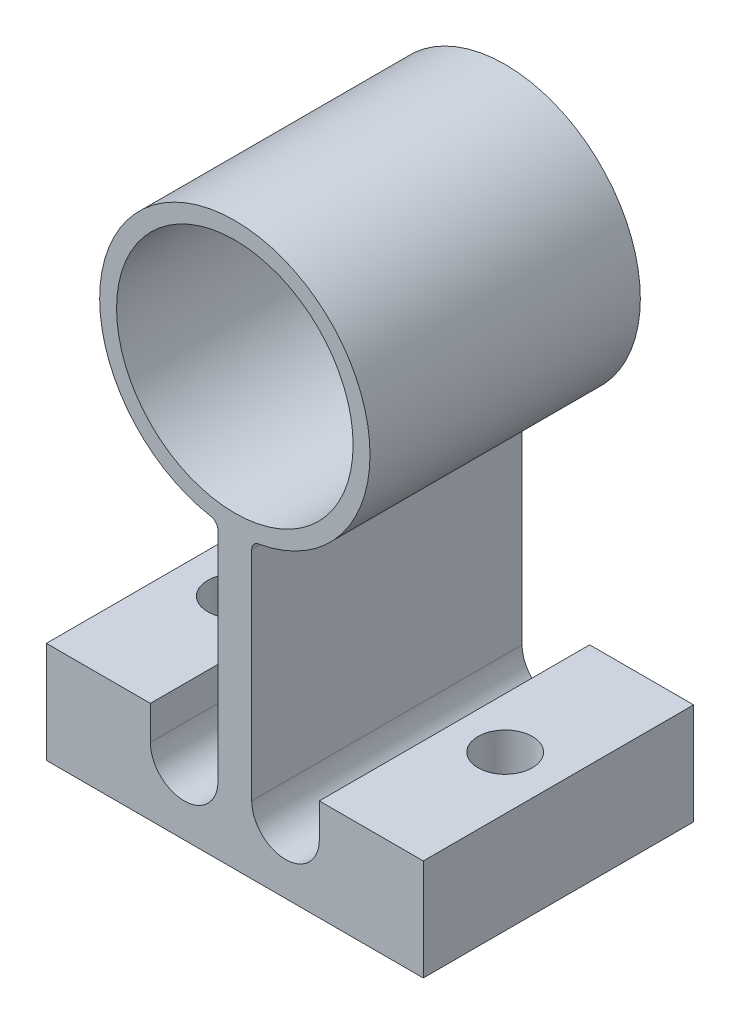
from build123d import *

# Parameters (mm, degrees)
SKETCH1_R                  = 11.1125
EXTRUDE1_DEPTH             = 12.7
BUSHING_SIDE_FILLETS_R     = 0.79375
MOUNT_SIDE_FILLETS_R       = 0.79375
F_1_4_MOUNTING_HOLES_D     = 5.1054
F_1_4_MOUNTING_HOLES_DEPTH = 19.05
F_1_4_MOUNTING_HOLES_TIP   = 1.533816902
EXTRUDE2_DEPTH             = 51.649420448


with BuildPart() as part:
    # Sketch1 → Extrude1 (new, symmetric)
    with BuildSketch(Plane(origin=(0, 0, 0), x_dir=(1, 0, 0), z_dir=(0, 0, -1))):
        with BuildLine():
            Line((-17.705953405, 40.0837), (17.705953405, 40.0837))
            Line((17.705953405, 40.0837), (17.705953405, 30.5587))
            Line((17.705953405, 30.5587), (1.5875, 30.5587))
            Line((1.5875, 30.5587), (1.5875, 12.600390619))
            ThreePointArc((1.5875, 12.600390619), (0, -12.7), (-1.5875, 12.600390619))
            Line((-1.5875, 12.600390619), (-1.5875, 30.5587))
            Line((-1.5875, 30.5587), (-17.705953405, 30.5587))
            Line((-17.705953405, 30.5587), (-17.705953405, 40.0837))
        make_face()
        Circle(SKETCH1_R, mode=Mode.SUBTRACT)
    extrude(amount=EXTRUDE1_DEPTH, both=True)

    # Bushing-side fillets
    bushing_side_fillets_edges = [part.edges().sort_by_distance(p)[0] for p in [
        (1.5875, -12.600390619, 0),
        (-1.5875, -12.600390619, 0),
    ]]
    fillet(bushing_side_fillets_edges, radius=BUSHING_SIDE_FILLETS_R)

    # Mount-side fillets
    mount_side_fillets_edges = [part.edges().sort_by_distance(p)[0] for p in [
        (1.5875, -30.5587, 0),
        (-1.5875, -30.5587, 0),
    ]]
    fillet(mount_side_fillets_edges, radius=MOUNT_SIDE_FILLETS_R)

    # 1/4 Mounting holes
    with Locations(Plane.XZ.offset(40.0837)):
        with Locations((-12.7, 0), (12.7, 0)):
            Hole(F_1_4_MOUNTING_HOLES_D / 2, depth=F_1_4_MOUNTING_HOLES_DEPTH)
            with Locations((0, 0, -(F_1_4_MOUNTING_HOLES_DEPTH + F_1_4_MOUNTING_HOLES_TIP / 2))):  # 118° drill point
                Cone(0, F_1_4_MOUNTING_HOLES_D / 2, F_1_4_MOUNTING_HOLES_TIP, mode=Mode.SUBTRACT)

    # Sketch4 → Extrude2 (cut, through all)
    with BuildSketch(Plane(origin=(0, 0, -12.7), x_dir=(-1, 0, 0), z_dir=(0, 0, -1))):
        with BuildLine():
            Line((1.5875, -29.76495), (1.5875, -33.7337))
            ThreePointArc((1.5875, -33.7337), (4.7625, -36.9087), (7.9375, -33.7337))
            Line((7.9375, -33.7337), (7.9375, -30.5587))
            Line((7.9375, -30.5587), (2.38125, -30.5587))
            ThreePointArc((2.38125, -30.5587), (1.819983992, -30.326216008), (1.5875, -29.76495))
        make_face()
        with BuildLine():
            Line((-7.9375, -30.5587), (-2.38125, -30.5587))
            ThreePointArc((-2.38125, -30.5587), (-1.819983992, -30.326216008), (-1.5875, -29.76495))
            Line((-1.5875, -29.76495), (-1.5875, -33.7337))
            ThreePointArc((-1.5875, -33.7337), (-4.7625, -36.9087), (-7.9375, -33.7337))
            Line((-7.9375, -33.7337), (-7.9375, -30.5587))
        make_face()
    extrude(amount=-EXTRUDE2_DEPTH, mode=Mode.SUBTRACT)


solid = part.part
